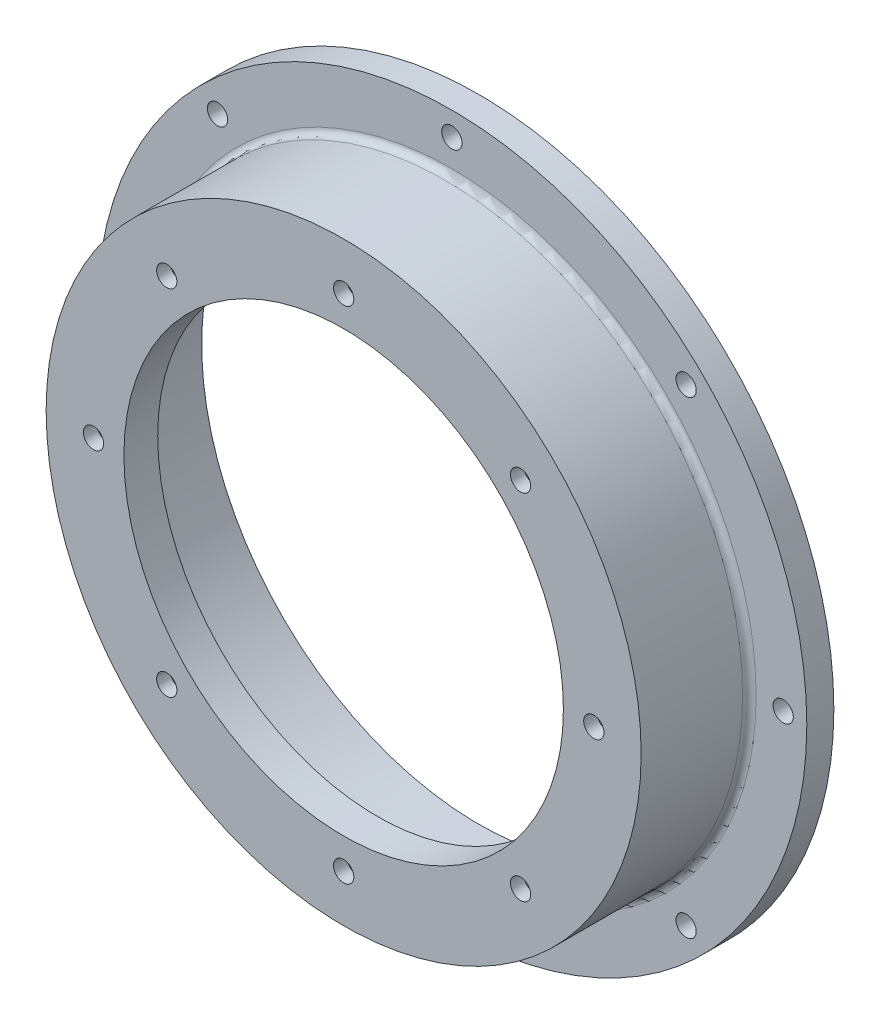
from build123d import *

# Parameters (mm, degrees)
SKETCH1_R                       = 41
SKETCH1_R_2                     = 32.5
BOSS_EXTRUDE1_DEPTH             = 5
BOSS_EXTRUDE2_DEPTH             = 5
BOSS_EXTRUDE2_DEPTH_BACK        = 15
SKETCH1_4_R                     = 52.5
SKETCH1_4_R_2                   = 41
F_3_0MM_DOWEL_HOLE1_D           = 3
F_3_0MM_DOWEL_HOLE1_CSINK_D     = 3.05
F_3_0MM_DOWEL_HOLE1_CSINK_ANGLE = 90
SKETCH7_R                       = 3.5
CUT_EXTRUDE1_DEPTH              = 3
F_3_0MM_DOWEL_HOLE2_D           = 3
F_3_0MM_DOWEL_HOLE2_CSINK_D     = 3.05
F_3_0MM_DOWEL_HOLE2_CSINK_ANGLE = 90
SKETCH13_R                      = 52.5
SKETCH13_R_2                    = 1.5
SKETCH13_R_3                    = 44
CUT_EXTRUDE2_DEPTH              = 16
FILLET1_R                       = 0.5
FILLET2_R                       = 1


with BuildPart() as part:
    # Sketch1 → Boss-Extrude1 (new body)
    with BuildSketch(Plane.XY):
        Circle(SKETCH1_R)
        Circle(SKETCH1_R_2, mode=Mode.SUBTRACT)
    extrude(amount=BOSS_EXTRUDE1_DEPTH)

    # Sketch1<4> → Boss-Extrude2 (add, two sides: drawn at the far end of the back side and taken through both)
    with BuildSketch(Plane.XY.offset(-BOSS_EXTRUDE2_DEPTH_BACK)):
        Circle(SKETCH1_4_R)
        Circle(SKETCH1_4_R_2, mode=Mode.SUBTRACT)
    extrude(amount=BOSS_EXTRUDE2_DEPTH + BOSS_EXTRUDE2_DEPTH_BACK)

    # Ø3.0mm Dowel Hole1 (through all)
    with Locations(Plane(origin=(0, 0, 0), x_dir=(-1, 0, 0), z_dir=(0, 0, -1))):
        with Locations((-26.162950904, 26.162950904), (0, 37), (26.162950904, 26.162950904), (37, 0), (-37, 0), (0, -37), (26.162950904, -26.162950904), (-26.162950904, -26.162950904)):
            CounterSinkHole(F_3_0MM_DOWEL_HOLE1_D / 2, F_3_0MM_DOWEL_HOLE1_CSINK_D / 2, counter_sink_angle=F_3_0MM_DOWEL_HOLE1_CSINK_ANGLE)

    # Sketch7 → Cut-Extrude1 (cut)
    with BuildSketch(Plane.XY):
        with Locations((0, 37)):
            Circle(SKETCH7_R)
        with Locations((26.162950904, 26.162950904)):
            Circle(SKETCH7_R)
        with Locations((37, 0)):
            Circle(SKETCH7_R)
        with Locations((26.162950904, -26.162950904)):
            Circle(SKETCH7_R)
        with Locations((0, -37)):
            Circle(SKETCH7_R)
        with Locations((-26.162950904, -26.162950904)):
            Circle(SKETCH7_R)
        with Locations((-37, 0)):
            Circle(SKETCH7_R)
        with Locations((-26.162950904, 26.162950904)):
            Circle(SKETCH7_R)
    extrude(amount=CUT_EXTRUDE1_DEPTH, mode=Mode.SUBTRACT)

    # Ø3.0mm Dowel Hole2 (through all)
    with Locations(Plane(origin=(0, 0, -15), x_dir=(-1, 0, 0), z_dir=(0, 0, -1))):
        with Locations((0, 49), (34.648232278, 34.648232278), (-34.648232278, 34.648232278), (-49, 0), (-34.648232278, -34.648232278), (49, 0), (34.648232278, -34.648232278), (0, -49)):
            CounterSinkHole(F_3_0MM_DOWEL_HOLE2_D / 2, F_3_0MM_DOWEL_HOLE2_CSINK_D / 2, counter_sink_angle=F_3_0MM_DOWEL_HOLE2_CSINK_ANGLE)

    # Sketch13 → Cut-Extrude2 (cut)
    with BuildSketch(Plane.XY.offset(5)):
        Circle(SKETCH13_R)
        with Locations(Location((-34.648232278, -34.648232278, 0), (0, 0, 180.000000005))):
            Circle(SKETCH13_R_2, mode=Mode.SUBTRACT)
        with Locations(Location((0, -49, 0), (0, 0, 180))):
            Circle(SKETCH13_R_2, mode=Mode.SUBTRACT)
        with Locations(Location((34.648232278, -34.648232278, 0), (0, 0, 180.000000005))):
            Circle(SKETCH13_R_2, mode=Mode.SUBTRACT)
        with Locations(Location((-49, 0, 0), (0, 0, 180))):
            Circle(SKETCH13_R_2, mode=Mode.SUBTRACT)
        with Locations(Location((-34.648232278, 34.648232278, 0), (0, 0, 179.999999995))):
            Circle(SKETCH13_R_2, mode=Mode.SUBTRACT)
        Circle(SKETCH13_R_3, mode=Mode.SUBTRACT)
        with Locations(Location((49, 0, 0), (0, 0, 180))):
            Circle(SKETCH13_R_2, mode=Mode.SUBTRACT)
        with Locations(Location((0, 49, 0), (0, 0, 180))):
            Circle(SKETCH13_R_2, mode=Mode.SUBTRACT)
        with Locations(Location((34.648232278, 34.648232278, 0), (0, 0, 179.999999995))):
            Circle(SKETCH13_R_2, mode=Mode.SUBTRACT)
    extrude(amount=-CUT_EXTRUDE2_DEPTH, mode=Mode.SUBTRACT)

    # Fillet1
    fillet1_edges = [part.edges().sort_by_distance(p)[0] for p in [
        (-41, 0, 0),
    ]]
    fillet(fillet1_edges, radius=FILLET1_R - 0.0001)  # a hair under: the kernel refuses the full size

    # Fillet2
    fillet2_edges = [part.edges().sort_by_distance(p)[0] for p in [
        (-44, 0, -11),
    ]]
    fillet(fillet2_edges, radius=FILLET2_R)


solid = part.part
